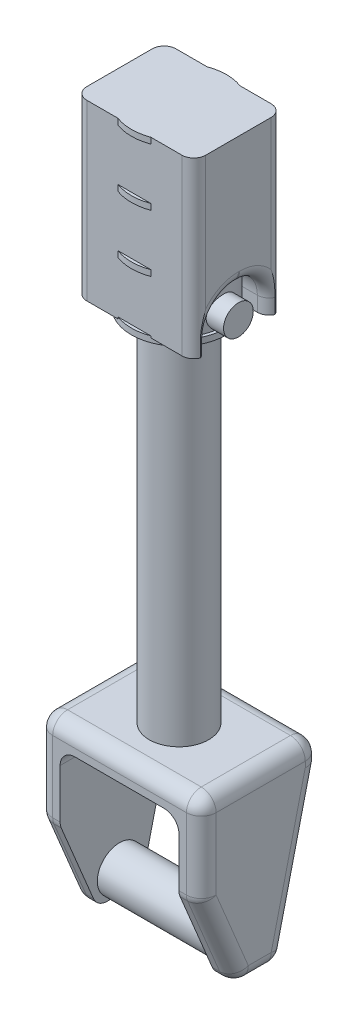
from build123d import *

# Parameters (mm, degrees)
BOSS_EXTRUDE1_DEPTH       = 101.6
SKETCH2_R                 = 19.05
BOSS_EXTRUDE2_DEPTH       = 120.65
CUT_EXTRUDE1_REACH        = 263.894
FILLET1_R                 = 12.7
FILLET2_R                 = 12.7
SKETCH5_R                 = 25.4
BOSS_EXTRUDE3_DEPTH       = 307.34
SKETCH6_R                 = 40.64
BOSS_EXTRUDE4_DEPTH       = 5.08
SKETCH7_R                 = 38.1
BOSS_EXTRUDE5_DEPTH       = 43.942
FILLET5_R                 = 7.62
SKETCH8_R                 = 40.64
BOSS_EXTRUDE6_DEPTH       = 5.08
SKETCH9_R                 = 38.1
BOSS_EXTRUDE7_DEPTH       = 43.942
FILLET6_R                 = 7.62
SKETCH10_R                = 40.64
BOSS_EXTRUDE8_DEPTH       = 5.08
SKETCH11_R                = 38.1
BOSS_EXTRUDE9_DEPTH       = 43.942
FILLET7_R                 = 7.62
SKETCH12_R                = 40.64
BOSS_EXTRUDE10_DEPTH      = 5.08
BOSS_EXTRUDE11_DEPTH      = 50.8
BOSS_EXTRUDE11_DEPTH_BACK = 50.8
SKETCH13_R                = 12.7
FILLET3_R                 = 10.16
FILLET4_R                 = 10.16


with BuildPart() as part:
    # Sketch1 → Boss-Extrude1 (new body)
    with BuildSketch(Plane.XY):
        Polygon((-50.8, -196.85), (-69.85, -196.85), (-69.85, -44.45), (69.85, -44.45), (69.85, -196.85), (50.8, -196.85), (50.8, -63.5), (-50.8, -63.5), align=None)
    extrude(amount=-BOSS_EXTRUDE1_DEPTH)

    # Sketch2 → Boss-Extrude2 (add)
    with BuildSketch(Plane(origin=(69.85, 0, 0), x_dir=(0, 0, -1), z_dir=(1, 0, 0))):
        with Locations(Location((50.8, -177.8, 0), (0, 0, 270))):
            Circle(SKETCH2_R)
    extrude(amount=-BOSS_EXTRUDE2_DEPTH)

    # Cut-Extrude1: up to this face of the body (flat: up to its plane)
    cut_extrude1_end = Plane(part.part.faces().sort_by_distance((-69.85, -120.65, -50.8))[0])
    # Sketch4 → Cut-Extrude1 (cut, up to the picked face)
    with BuildSketch(Plane(origin=(69.85, 0, 0), x_dir=(0, 0, -1), z_dir=(1, 0, 0)), mode=Mode.PRIVATE) as cut_extrude1_sk1:
        Polygon((0, -196.85), (31.75, -196.85), (0, -120.65), align=None)
    cut_extrude1_tool1 = split(extrude(cut_extrude1_sk1.sketch, amount=-CUT_EXTRUDE1_REACH, mode=Mode.PRIVATE), bisect_by=cut_extrude1_end, keep=Keep.BOTH, mode=Mode.PRIVATE)
    # Sketch4 → Cut-Extrude1 (cut, up to the picked face)
    with BuildSketch(Plane(origin=(69.85, 0, 0), x_dir=(0, 0, -1), z_dir=(1, 0, 0)), mode=Mode.PRIVATE) as cut_extrude1_sk2:
        Polygon((101.6, -63.5), (69.85, -196.85), (101.6, -196.85), align=None)
    cut_extrude1_tool2 = split(extrude(cut_extrude1_sk2.sketch, amount=-CUT_EXTRUDE1_REACH, mode=Mode.PRIVATE), bisect_by=cut_extrude1_end, keep=Keep.BOTH, mode=Mode.PRIVATE)
    add(cut_extrude1_tool1.solids().sort_by(Axis((69.85, -171.45, -10.583333), (-1, 0, 0)))[0], mode=Mode.SUBTRACT)
    add(cut_extrude1_tool2.solids().sort_by(Axis((69.85, -152.4, -91.016667), (-1, 0, 0)))[0], mode=Mode.SUBTRACT)

    # Fillet1
    fillet1_edges = [part.edges().sort_by_distance(p)[0] for p in [
        (50.8, -63.5, -50.8),
        (-50.8, -63.5, -50.8),
        (0, -44.45, -101.6),
        (60.325, -120.65, 0),
        (-60.325, -120.65, 0),
        (-60.325, -196.85, -31.75),
        (60.325, -196.85, -31.75),
        (-60.325, -196.85, -69.85),
        (60.325, -196.85, -69.85),
        (0, -44.45, 0),
    ]]
    fillet(fillet1_edges, radius=FILLET1_R)

    # Fillet2
    fillet2_edges = [part.edges().sort_by_distance(p)[0] for p in [
        (69.85, -48.169743879, -3.719743879),
        (69.85, -60.325, -101.6),
        (-69.85, -87.63, 0),
        (69.85, -87.63, 0),
        (-69.85, -156.014615385, -14.73525641),
        (-69.85, -44.45, -50.8),
        (-69.85, -60.325, -101.6),
        (-69.85, -125.295790348, -86.886716584),
        (-69.85, -196.85, -50.017730454),
        (-69.85, -120.600674916, -0.246625419),
        (-69.85, -194.717038738, -33.171974175),
        (-69.85, -194.116144562, -67.69064044),
        (-69.85, -48.169743879, -97.880256121),
        (-69.85, -48.169743879, -3.719743879),
        (69.85, -44.45, -50.8),
        (69.85, -156.014615385, -14.73525641),
        (69.85, -196.85, -50.017730454),
        (69.85, -125.295790348, -86.886716584),
        (69.85, -120.600674916, -0.246625419),
        (69.85, -194.116144562, -67.69064044),
        (69.85, -194.717038738, -33.171974175),
        (69.85, -48.169743879, -97.880256121),
    ]]
    fillet(fillet2_edges, radius=FILLET2_R)

    # Sketch5 → Boss-Extrude3 (add)
    with BuildSketch(Plane(origin=(0, -44.45, 0), x_dir=(1, 0, 0), z_dir=(0, 1, 0))):
        with Locations(Location((0, 50.8, 0), (0, 0, 270))):
            Circle(SKETCH5_R)
    extrude(amount=BOSS_EXTRUDE3_DEPTH)

    # Sketch6 → Boss-Extrude4 (add)
    with BuildSketch(Plane(origin=(0, 262.89, 0), x_dir=(1, 0, 0), z_dir=(0, 1, 0))):
        with Locations(Location((0, 50.8, 0), (0, 0, 270))):
            Circle(SKETCH6_R)
    extrude(amount=BOSS_EXTRUDE4_DEPTH)

    # Sketch7 → Boss-Extrude5 (add)
    with BuildSketch(Plane(origin=(0, 267.97, 0), x_dir=(1, 0, 0), z_dir=(0, 1, 0))):
        with Locations(Location((0, 50.8, 0), (0, 0, 90))):
            Circle(SKETCH7_R)
    extrude(amount=BOSS_EXTRUDE5_DEPTH)

    # Fillet5
    fillet5_edges = [part.edges().sort_by_distance(p)[0] for p in [
        (0, 311.912, -12.7),
    ]]
    fillet(fillet5_edges, radius=FILLET5_R)

    # Sketch8 → Boss-Extrude6 (add)
    with BuildSketch(Plane(origin=(0, 311.912, 0), x_dir=(1, 0, 0), z_dir=(0, 1, 0))):
        with Locations(Location((0, 50.8, 0), (0, 0, 270))):
            Circle(SKETCH8_R)
    extrude(amount=BOSS_EXTRUDE6_DEPTH)

    # Sketch9 → Boss-Extrude7 (add)
    with BuildSketch(Plane(origin=(0, 316.992, 0), x_dir=(1, 0, 0), z_dir=(0, 1, 0))):
        with Locations(Location((0, 50.8, 0), (0, 0, 90))):
            Circle(SKETCH9_R)
    extrude(amount=BOSS_EXTRUDE7_DEPTH)

    # Fillet6
    fillet6_edges = [part.edges().sort_by_distance(p)[0] for p in [
        (0, 360.934, -12.7),
    ]]
    fillet(fillet6_edges, radius=FILLET6_R)

    # Sketch10 → Boss-Extrude8 (add)
    with BuildSketch(Plane(origin=(0, 360.934, 0), x_dir=(1, 0, 0), z_dir=(0, 1, 0))):
        with Locations(Location((0, 50.8, 0), (0, 0, 270))):
            Circle(SKETCH10_R)
    extrude(amount=BOSS_EXTRUDE8_DEPTH)

    # Sketch11 → Boss-Extrude9 (add)
    with BuildSketch(Plane(origin=(0, 366.014, 0), x_dir=(1, 0, 0), z_dir=(0, 1, 0))):
        with Locations(Location((0, 50.8, 0), (0, 0, 90))):
            Circle(SKETCH11_R)
    extrude(amount=BOSS_EXTRUDE9_DEPTH)

    # Fillet7
    fillet7_edges = [part.edges().sort_by_distance(p)[0] for p in [
        (0, 409.956, -12.7),
    ]]
    fillet(fillet7_edges, radius=FILLET7_R)

    # Sketch12 → Boss-Extrude10 (add)
    with BuildSketch(Plane(origin=(0, 409.956, 0), x_dir=(1, 0, 0), z_dir=(0, 1, 0))):
        with Locations(Location((0, 50.8, 0), (0, 0, 270))):
            Circle(SKETCH12_R)
    extrude(amount=BOSS_EXTRUDE10_DEPTH)

    # Sketch13 → Boss-Extrude11 (add, two sides: drawn at the far end of the back side and taken through both)
    with BuildSketch(Plane(origin=(0, 0, 0), x_dir=(0, 0, -1), z_dir=(1, 0, 0)).offset(-BOSS_EXTRUDE11_DEPTH_BACK)):
        with Locations((50.8, 279.146)):
            Circle(SKETCH13_R)
        with BuildLine():
            Line((50.8, 415.036), (12.7, 415.036))
            Line((12.7, 415.036), (12.7, 266.446))
            Line((12.7, 266.446), (25.4, 266.446))
            Line((25.4, 266.446), (25.4, 279.146))
            ThreePointArc((25.4, 279.146), (32.839487758, 297.106512242), (50.8, 304.546))
            Line((50.8, 304.546), (51.778264307, 304.546))
            ThreePointArc((51.778264307, 304.546), (69.738776549, 297.106512242), (77.178264307, 279.146))
            Line((77.178264307, 279.146), (77.178264307, 266.446))
            Line((77.178264307, 266.446), (88.9, 266.446))
            Line((88.9, 266.446), (88.9, 415.036))
            Line((88.9, 415.036), (50.8, 415.036))
        make_face()
    extrude(amount=BOSS_EXTRUDE11_DEPTH + BOSS_EXTRUDE11_DEPTH_BACK)

    # Fillet3
    fillet3_edges = [part.edges().sort_by_distance(p)[0] for p in [
        (-50.8, 340.741, -88.9),
        (-50.8, 340.741, -12.7),
        (50.8, 340.741, -12.7),
        (50.8, 340.741, -88.9),
    ]]
    fillet(fillet3_edges, radius=FILLET3_R)

    # Fillet4
    # the kernel refuses this fillet: 10.16 mm, written as the material it takes off along each edge
    with BuildSketch(Plane(origin=(-50.8, 279.146, -77.178264307), x_dir=(0, 0, -1), z_dir=(0, -1, 0)), Plane(origin=(-50.8, 241.046, -25.4), x_dir=(0, 0, 1), z_dir=(0, 1, 0))) as fillet4_piece_1:
        with BuildLine():
            CenterArc((FILLET4_R, FILLET4_R), FILLET4_R, 180, 90)
            Line((0, FILLET4_R), (0, 0))
            Line((0, 0), (FILLET4_R, 0))
        make_face()
    extrude(amount=38.1, mode=Mode.SUBTRACT)
    with BuildSketch(Plane(origin=(-50.8, 279.146, -50.8), x_dir=(0, 0, 1), z_dir=(0, -1, 0))) as fillet4_piece_2:
        with BuildLine():
            CenterArc((25.4 + FILLET4_R, -FILLET4_R), FILLET4_R, 90, 90)
            Line((25.4, -FILLET4_R), (25.4, 0))
            Line((25.4, 0), (25.4 + FILLET4_R, 0))
        make_face()
    revolve(axis=Axis((-50.8, 279.146, -50.8), (-1, 0, 0)), revolution_arc=90, mode=Mode.SUBTRACT)
    with BuildSketch(Plane(origin=(-50.8, 304.546, -50.8), x_dir=(0, 1, 0), z_dir=(0, 0, -1))) as fillet4_piece_3:
        with BuildLine():
            CenterArc((FILLET4_R, FILLET4_R), FILLET4_R, 180, 90)
            Line((0, FILLET4_R), (0, 0))
            Line((0, 0), (FILLET4_R, 0))
        make_face()
    extrude(amount=0.978264307, mode=Mode.SUBTRACT)
    with BuildSketch(Plane(origin=(50.8, 279.146, -77.178264307), x_dir=(0, 0, -1), z_dir=(0, -1, 0)), Plane(origin=(50.8, 241.046, -25.4), x_dir=(0, 0, 1), z_dir=(0, 1, 0))) as fillet4_piece_4:
        with BuildLine():
            CenterArc((FILLET4_R, -FILLET4_R), FILLET4_R, 90, 90)
            Line((0, -FILLET4_R), (0, 0))
            Line((0, 0), (FILLET4_R, 0))
        make_face()
    extrude(amount=38.1, mode=Mode.SUBTRACT)
    with BuildSketch(Plane(origin=(50.8, 279.146, -51.778264307), x_dir=(0, 1, 0), z_dir=(0, 0, 1))) as fillet4_piece_5:
        with BuildLine():
            CenterArc((25.4 + FILLET4_R, FILLET4_R), FILLET4_R, 180, 90)
            Line((25.4, FILLET4_R), (25.4, 0))
            Line((25.4, 0), (25.4 + FILLET4_R, 0))
        make_face()
    revolve(axis=Axis((50.8, 279.146, -51.778264307), (-1, 0, 0)), revolution_arc=90, mode=Mode.SUBTRACT)
    with BuildSketch(Plane(origin=(50.8, 304.546, -50.8), x_dir=(0, 1, 0), z_dir=(0, 0, -1))) as fillet4_piece_6:
        with BuildLine():
            CenterArc((FILLET4_R, -FILLET4_R), FILLET4_R, 90, 90)
            Line((0, -FILLET4_R), (0, 0))
            Line((0, 0), (FILLET4_R, 0))
        make_face()
    extrude(amount=0.978264307, mode=Mode.SUBTRACT)
    with BuildSketch(Plane(origin=(-50.8, 279.146, -51.778264307), x_dir=(0, 1, 0), z_dir=(0, 0, 1))) as fillet4_piece_7:
        with BuildLine():
            CenterArc((25.4 + FILLET4_R, -FILLET4_R), FILLET4_R, 90, 90)
            Line((25.4, -FILLET4_R), (25.4, 0))
            Line((25.4, 0), (25.4 + FILLET4_R, 0))
        make_face()
    revolve(axis=Axis((-50.8, 279.146, -51.778264307), (-1, 0, 0)), revolution_arc=90, mode=Mode.SUBTRACT)
    with BuildSketch(Plane(origin=(50.8, 279.146, -50.8), x_dir=(0, 0, 1), z_dir=(0, -1, 0))) as fillet4_piece_8:
        with BuildLine():
            CenterArc((25.4 + FILLET4_R, FILLET4_R), FILLET4_R, 180, 90)
            Line((25.4, FILLET4_R), (25.4, 0))
            Line((25.4, 0), (25.4 + FILLET4_R, 0))
        make_face()
    revolve(axis=Axis((50.8, 279.146, -50.8), (-1, 0, 0)), revolution_arc=90, mode=Mode.SUBTRACT)


solid = part.part
